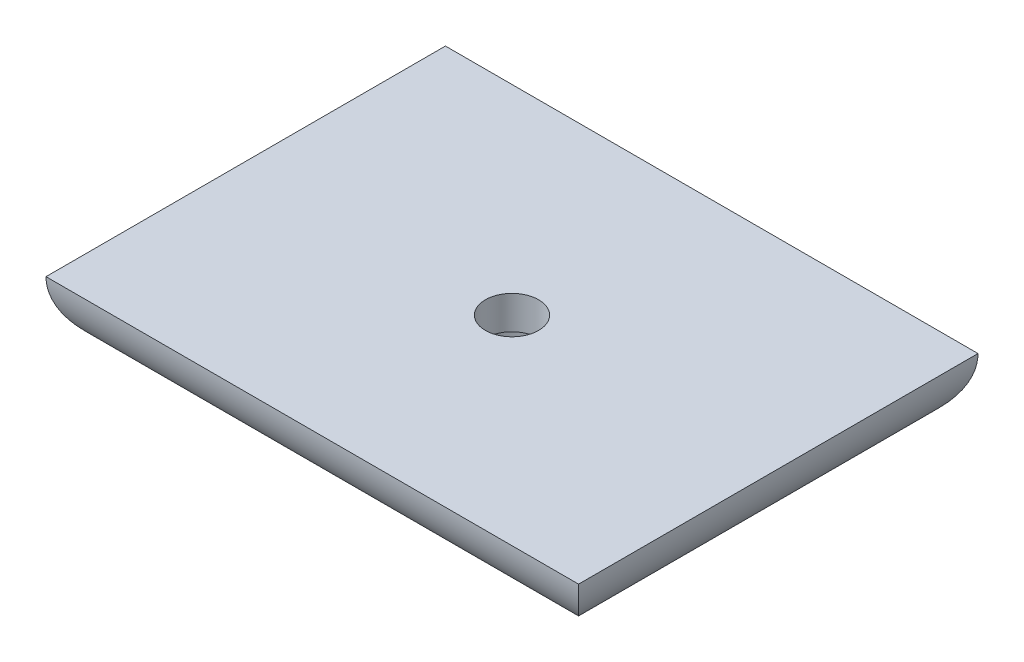
from build123d import *

# Parameters (mm, degrees)
ESQUISSE1_W     = 40
ESQUISSE1_H     = 30
ESQUISSE1_R     = 2
BASE_DEPTH      = 5
EXT_R           = 5
ESQUISSE2_R     = 4
ACCES_VIS_DEPTH = 2.5


with BuildPart() as part:
    # Esquisse1 → BASE (new body)
    with BuildSketch(Plane(origin=(0, 0, 0), x_dir=(1, 0, 0), z_dir=(0, 1, 0))):
        Rectangle(ESQUISSE1_W, ESQUISSE1_H)
        with Locations(Location((0, 0, 0), (0, 0, 270))):
            Circle(ESQUISSE1_R, mode=Mode.SUBTRACT)
    extrude(amount=BASE_DEPTH)

    # EXT
    ext_edges = [part.edges().sort_by_distance(p)[0] for p in [
        (-20, 0, 0),
        (0, 0, -15),
        (20, 0, 0),
        (0, 0, 15),
    ]]
    fillet(ext_edges, radius=EXT_R - 0.0001)  # a hair under: the kernel refuses the full size

    # Esquisse2 → ACCES VIS (cut)
    with BuildSketch(Plane(origin=(0, 0, 0), x_dir=(-1, 0, 0), z_dir=(0, -1, 0))):
        with Locations(Location((0, 0, 0), (0, 0, 90))):
            Circle(ESQUISSE2_R)
    extrude(amount=-ACCES_VIS_DEPTH, mode=Mode.SUBTRACT)


solid = part.part
